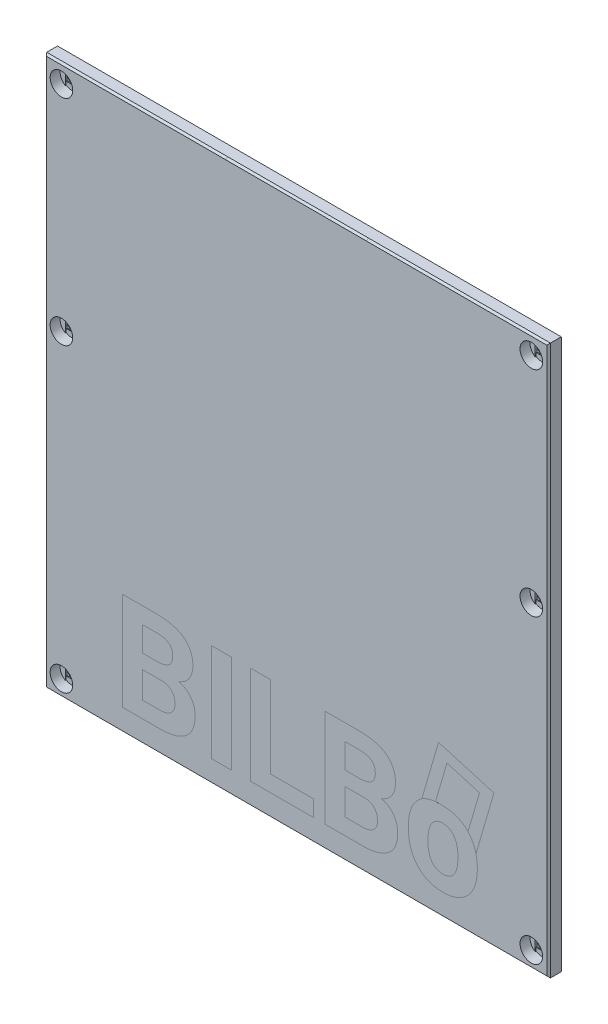
from build123d import *
from build123d.topology import SkipClean

# Parameters (mm, degrees)
SKETCH1_R             = 1.35
BOSS_EXTRUDE1_DEPTH   = 2.8
SKETCH3_R             = 2.5
CUT_EXTRUDE1_DEPTH    = 2.2
SKETCH4_W             = 91.3
SKETCH4_H             = 85.4
CUT_EXTRUDE2_DEPTH    = 1.5
CUT_EXTRUDE3_DEPTH    = 0.2
SKETCH6_W             = 2.7
SKETCH6_H             = 2.7
CUT_EXTRUDE4_DEPTH    = 0.2
CHAMFER1_SIZE         = 0.4
BOSS_EXTRUDE4_START   = -2.8
SKETCH11_W            = 31.175
SKETCH11_H            = 25.7
BOSS_EXTRUDE4_DEPTH   = 2.8
CHAMFER2_SIZE         = 0.4
SKETCH13_W            = 4.464730949
SKETCH13_H            = 21.668834196
CUT_EXTRUDE5_DEPTH    = 0.6
BOSS_EXTRUDE6_DEPTH   = 0.6
SKETCH13_4_W          = 4.464730949
SKETCH13_4_H          = 21.668834196
BOSS_EXTRUDE6_2_DEPTH = 0.6
BOSS_EXTRUDE6_3_DEPTH = 0.6
BOSS_EXTRUDE6_4_DEPTH = 0.6
BOSS_EXTRUDE6_5_DEPTH = 0.6
CUT_EXTRUDE6_DEPTH    = 0.6
BOSS_EXTRUDE7_DEPTH   = 0.6


with BuildPart() as part:
    # Sketch1 → Boss-Extrude1 (new body)
    with BuildSketch(Plane.XY):
        Polygon((-15.25, 54.05), (-15.25, 28.75), (15.125, 28.75), (15.125, 54.05), (55.825, 54.05), (55.825, -67.65), (-55.65, -67.65), (-55.65, 54.05), align=None)
        with Locations((-52, 50)):
            Circle(SKETCH1_R, mode=Mode.SUBTRACT)
        with Locations((-52, 2.6)):
            Circle(SKETCH1_R, mode=Mode.SUBTRACT)
        with Locations((-52, -64)):
            Circle(SKETCH1_R, mode=Mode.SUBTRACT)
        with Locations((52, 50)):
            Circle(SKETCH1_R, mode=Mode.SUBTRACT)
        with Locations((52, 2.6)):
            Circle(SKETCH1_R, mode=Mode.SUBTRACT)
        with Locations((52, -64)):
            Circle(SKETCH1_R, mode=Mode.SUBTRACT)
    extrude(amount=BOSS_EXTRUDE1_DEPTH)

    # Sketch3 → Cut-Extrude1 (cut)
    with BuildSketch(Plane.XY.offset(2.8)):
        with Locations((-52, 50)):
            Circle(SKETCH3_R)
        with Locations((-52, 2.6)):
            Circle(SKETCH3_R)
        with Locations((-52, -64)):
            Circle(SKETCH3_R)
        with Locations((52, -64)):
            Circle(SKETCH3_R)
        with Locations((52, 2.6)):
            Circle(SKETCH3_R)
        with Locations((52, 50)):
            Circle(SKETCH3_R)
    extrude(amount=-CUT_EXTRUDE1_DEPTH, mode=Mode.SUBTRACT)

    # Sketch4 → Cut-Extrude2 (cut)
    with BuildSketch(Plane(origin=(0, 0, 0), x_dir=(-1, 0, 0), z_dir=(0, 0, -1))):
        with Locations((0, -14.95)):
            Rectangle(SKETCH4_W, SKETCH4_H)
    extrude(amount=-CUT_EXTRUDE2_DEPTH, mode=Mode.SUBTRACT)

    # Sketch5 → Cut-Extrude3 (cut)
    with SkipClean():  # the faces are left unmerged after this step: merging them gives an invalid solid
        with BuildSketch(Plane.XY.offset(0.6)):
            with BuildLine():
                Line((-53.35, 47.895837459), (-53.35, 52.104162541))
                ThreePointArc((-53.35, 52.104162541), (-52, 52.5), (-50.65, 52.104162541))
                Line((-50.65, 52.104162541), (-50.65, 47.895837459))
                ThreePointArc((-50.65, 47.895837459), (-52, 47.5), (-53.35, 47.895837459))
            make_face()
            with BuildLine():
                Line((-53.35, 0.495837459), (-53.35, 4.704162541))
                ThreePointArc((-53.35, 4.704162541), (-52, 5.1), (-50.65, 4.704162541))
                Line((-50.65, 4.704162541), (-50.65, 0.495837459))
                ThreePointArc((-50.65, 0.495837459), (-52, 0.1), (-53.35, 0.495837459))
            make_face()
            with BuildLine():
                Line((-53.35, -66.104162541), (-53.35, -61.895837459))
                ThreePointArc((-53.35, -61.895837459), (-52, -61.5), (-50.65, -61.895837459))
                Line((-50.65, -61.895837459), (-50.65, -66.104162541))
                ThreePointArc((-50.65, -66.104162541), (-52, -66.5), (-53.35, -66.104162541))
            make_face()
        cut_extrude3 = extrude(amount=-CUT_EXTRUDE3_DEPTH, mode=Mode.SUBTRACT)

    # Sketch6 → Cut-Extrude4 (cut)
    with SkipClean():  # the faces are left unmerged after this step: merging them gives an invalid solid
        with BuildSketch(Plane.XY.offset(0.4)):
            with Locations((-52, -64)):
                Rectangle(SKETCH6_W, SKETCH6_H)
            with Locations((-52, 2.6)):
                Rectangle(SKETCH6_W, SKETCH6_H)
            with Locations((-52, 50)):
                Rectangle(SKETCH6_W, SKETCH6_H)
        cut_extrude4 = extrude(amount=-CUT_EXTRUDE4_DEPTH, mode=Mode.SUBTRACT)

    # Mirror1: Cut-Extrude3, Cut-Extrude4 across plane
    with SkipClean():  # the faces are left unmerged after this step: merging them gives an invalid solid
        add(cut_extrude3.mirror(Plane(origin=(0, 0, 0), x_dir=(0, 0, 1), z_dir=(1, 0, 0))), mode=Mode.SUBTRACT)
        add(cut_extrude4.mirror(Plane(origin=(0, 0, 0), x_dir=(0, 0, 1), z_dir=(1, 0, 0))), mode=Mode.SUBTRACT)

    # Chamfer1
    chamfer1_edges = [part.edges().sort_by_distance(p)[0] for p in [
        (55.825, -6.8, 2.8),
        (35.475, 54.05, 2.8),
        (15.125, 41.4, 2.8),
        (-0.0625, 28.75, 2.8),
        (-15.25, 41.4, 2.8),
        (-35.45, 54.05, 2.8),
        (-55.65, -6.8, 2.8),
        (0.0875, -67.65, 2.8),
    ]]
    chamfer(chamfer1_edges, length=CHAMFER1_SIZE)

    # Sketch11 → Boss-Extrude4 (add)
    with SkipClean():  # the faces are left unmerged after this step: merging them gives an invalid solid
        with BuildSketch(Plane.XY.offset(2.8).offset(BOSS_EXTRUDE4_START)):
            with Locations((-0.0625, 41.2)):
                Rectangle(SKETCH11_W, SKETCH11_H)
        extrude(amount=BOSS_EXTRUDE4_DEPTH)

    # Chamfer2
    chamfer2_edges = [part.edges().sort_by_distance(p)[0] for p in [
        (-0.0625, 54.05, 2.8),
    ]]
    chamfer(chamfer2_edges, length=CHAMFER2_SIZE - 0.0001)  # a hair under: the kernel refuses the full size

    # Sketch13 → Cut-Extrude5 (cut)
    # profile 1 of 5: a face of its own
    with BuildSketch(Plane.XY.offset(2.8)):
        with BuildLine():
            add(Edge.make_bspline(
                [(-24.407221393, -61.076300822), (-25.736719114, -62.147835169), (-27.631749376, -62.693531332), (-30.092312179, -62.713375811)],
                knots=[0, 0, 0, 0, 1, 1, 1, 1], degree=3))
            Line((-30.092312179, -62.713375811), (-38.51577092, -62.713375811))
            Line((-38.51577092, -62.713375811), (-38.51577092, -41.044541615))
            Line((-38.51577092, -41.044541615), (-30.925728983, -41.044541615))
            add(Edge.make_bspline(
                [(-30.925728983, -41.044541615), (-28.296498911, -41.044541615), (-26.302251655, -41.550548821), (-24.942988567, -42.562549733)],
                knots=[0, 0, 0, 0, 1, 1, 1, 1], degree=3))
            add(Edge.make_bspline(
                [(-24.942988567, -42.562549733), (-23.583726829, -43.564641905), (-22.904095285, -45.037993195), (-22.904095285, -46.982630604)],
                knots=[0, 0, 0, 0, 1, 1, 1, 1], degree=3))
            add(Edge.make_bspline(
                [(-22.904095285, -46.982630604), (-22.904095285, -48.044256212), (-23.176940667, -48.981847079), (-23.72263008, -49.795416704)],
                knots=[0, 0, 0, 0, 1, 1, 1, 1], degree=3))
            add(Edge.make_bspline(
                [(-23.72263008, -49.795416704), (-24.268319493, -50.59906409), (-25.027323552, -51.18940358), (-25.999642256, -51.566421674)],
                knots=[0, 0, 0, 0, 1, 1, 1, 1], degree=3))
            add(Edge.make_bspline(
                [(-25.999642256, -51.566421674), (-24.888420301, -51.844230876), (-24.01531724, -52.404803648), (-23.380333073, -53.248139991)],
                knots=[0, 0, 0, 0, 1, 1, 1, 1], degree=3))
            add(Edge.make_bspline(
                [(-23.380333073, -53.248139991), (-22.735428016, -54.091476334), (-22.412975488, -55.123335224), (-22.412975488, -56.343689661)],
                knots=[0, 0, 0, 0, 1, 1, 1, 1], degree=3))
            add(Edge.make_bspline(
                [(-22.412975488, -56.343689661), (-22.412975488, -58.42723842), (-23.077723673, -60.004766474), (-24.407221393, -61.076300822)],
                knots=[0, 0, 0, 0, 1, 1, 1, 1], degree=3))
        make_face()
        with BuildLine():
            add(Edge.make_bspline(
                [(-28.232007055, -45.315802397), (-28.797540947, -44.879250866), (-29.695448256, -44.660975101), (-30.925728983, -44.660975101)],
                knots=[0, 0, 0, 0, 1, 1, 1, 1], degree=3))
            Line((-30.925728983, -44.660975101), (-34.051039972, -44.660975101))
            Line((-34.051039972, -44.660975101), (-34.051039972, -50.122823602))
            Line((-34.051039972, -50.122823602), (-30.747139475, -50.122823602))
            add(Edge.make_bspline(
                [(-30.747139475, -50.122823602), (-28.494930197, -50.083134645), (-27.368826233, -49.185232735), (-27.368826233, -47.429104374)],
                knots=[0, 0, 0, 0, 1, 1, 1, 1], degree=3))
            add(Edge.make_bspline(
                [(-27.368826233, -47.429104374), (-27.368826233, -46.44687018), (-27.656553624, -45.742431688), (-28.232007055, -45.315802397)],
                knots=[0, 0, 0, 0, 1, 1, 1, 1], degree=3))
        make_face(mode=Mode.SUBTRACT)
        with BuildLine():
            add(Edge.make_bspline(
                [(-26.877706437, -56.299046334), (-26.877706437, -54.314719968), (-27.904594757, -53.307673427), (-29.958370048, -53.277906709)],
                knots=[0, 0, 0, 0, 1, 1, 1, 1], degree=3))
            Line((-29.958370048, -53.277906709), (-34.051039972, -53.277906709))
            Line((-34.051039972, -53.277906709), (-34.051039972, -59.126709043))
            Line((-34.051039972, -59.126709043), (-30.22625431, -59.126709043))
            add(Edge.make_bspline(
                [(-30.22625431, -59.126709043), (-29.174561741, -59.126709043), (-28.356028297, -58.87866656), (-27.770652626, -58.382581594)],
                knots=[0, 0, 0, 0, 1, 1, 1, 1], degree=3))
            add(Edge.make_bspline(
                [(-27.770652626, -58.382581594), (-27.175354716, -57.876574388), (-26.877706437, -57.182071635), (-26.877706437, -56.299046334)],
                knots=[0, 0, 0, 0, 1, 1, 1, 1], degree=3))
        make_face(mode=Mode.SUBTRACT)
    # profile 2 of 5: a face of its own
    with BuildSketch(Plane.XY.offset(2.8)):
        with Locations((-16.54929452, -51.878958713)):
            Rectangle(SKETCH13_W, SKETCH13_H)
    # profile 3 of 5: a face of its own
    with BuildSketch(Plane.XY.offset(2.8)):
        Polygon((-5.714880797, -41.044541615), (-5.714880797, -59.126709043), (3.765237033, -59.126709043), (3.765237033, -62.713375811), (-10.179611745, -62.713375811), (-10.179611745, -41.044541615), align=None)
    # profile 4 of 5: a face of its own
    with BuildSketch(Plane.XY.offset(2.8)):
        with BuildLine():
            add(Edge.make_bspline(
                [(20.433559607, -61.076300822), (19.104060537, -62.147835169), (17.209034324, -62.693531332), (14.748467471, -62.713375811)],
                knots=[0, 0, 0, 0, 1, 1, 1, 1], degree=3))
            Line((14.748467471, -62.713375811), (6.32501278, -62.713375811))
            Line((6.32501278, -62.713375811), (6.32501278, -41.044541615))
            Line((6.32501278, -41.044541615), (13.915053367, -41.044541615))
            add(Edge.make_bspline(
                [(13.915053367, -41.044541615), (16.544284789, -41.044541615), (18.538533395, -41.550548821), (19.897799183, -42.562549733)],
                knots=[0, 0, 0, 0, 1, 1, 1, 1], degree=3))
            add(Edge.make_bspline(
                [(19.897799183, -42.562549733), (21.257064971, -43.564641905), (21.936691115, -45.037993195), (21.936691115, -46.982630604)],
                knots=[0, 0, 0, 0, 1, 1, 1, 1], degree=3))
            add(Edge.make_bspline(
                [(21.936691115, -46.982630604), (21.936691115, -48.044256212), (21.663849783, -48.981847079), (21.11815362, -49.795416704)],
                knots=[0, 0, 0, 0, 1, 1, 1, 1], degree=3))
            add(Edge.make_bspline(
                [(21.11815362, -49.795416704), (20.572457457, -50.59906409), (19.813453399, -51.18940358), (18.841141444, -51.566421674)],
                knots=[0, 0, 0, 0, 1, 1, 1, 1], degree=3))
            add(Edge.make_bspline(
                [(18.841141444, -51.566421674), (19.952364749, -51.844230876), (20.82546781, -52.404803648), (21.460450627, -53.248139991)],
                knots=[0, 0, 0, 0, 1, 1, 1, 1], degree=3))
            add(Edge.make_bspline(
                [(21.460450627, -53.248139991), (22.105355684, -54.091476334), (22.427808212, -55.123335224), (22.427808212, -56.343689661)],
                knots=[0, 0, 0, 0, 1, 1, 1, 1], degree=3))
            add(Edge.make_bspline(
                [(22.427808212, -56.343689661), (22.427808212, -58.42723842), (21.763058677, -60.004766474), (20.433559607, -61.076300822)],
                knots=[0, 0, 0, 0, 1, 1, 1, 1], degree=3))
        make_face()
        with BuildLine():
            add(Edge.make_bspline(
                [(16.608772595, -45.315802397), (16.043245453, -44.879250866), (15.145343544, -44.660975101), (13.915053367, -44.660975101)],
                knots=[0, 0, 0, 0, 1, 1, 1, 1], degree=3))
            Line((13.915053367, -44.660975101), (10.789736978, -44.660975101))
            Line((10.789736978, -44.660975101), (10.789736978, -50.122823602))
            Line((10.789736978, -50.122823602), (14.093640175, -50.122823602))
            add(Edge.make_bspline(
                [(14.093640175, -50.122823602), (16.345853503, -50.083134645), (17.471953417, -49.185232735), (17.471953417, -47.429104374)],
                knots=[0, 0, 0, 0, 1, 1, 1, 1], degree=3))
            add(Edge.make_bspline(
                [(17.471953417, -47.429104374), (17.471953417, -46.44687018), (17.184221976, -45.742431688), (16.608772595, -45.315802397)],
                knots=[0, 0, 0, 0, 1, 1, 1, 1], degree=3))
        make_face(mode=Mode.SUBTRACT)
        with BuildLine():
            add(Edge.make_bspline(
                [(17.963070514, -56.299046334), (17.963070514, -54.314719968), (16.936179493, -53.307673427), (14.882410952, -53.277906709)],
                knots=[0, 0, 0, 0, 1, 1, 1, 1], degree=3))
            Line((14.882410952, -53.277906709), (10.789736978, -53.277906709))
            Line((10.789736978, -53.277906709), (10.789736978, -59.126709043))
            Line((10.789736978, -59.126709043), (14.61452399, -59.126709043))
            add(Edge.make_bspline(
                [(14.61452399, -59.126709043), (15.666213859, -59.126709043), (16.484751354, -58.87866656), (17.070122974, -58.382581594)],
                knots=[0, 0, 0, 0, 1, 1, 1, 1], degree=3))
            add(Edge.make_bspline(
                [(17.070122974, -58.382581594), (17.665416834, -57.876574388), (17.963070514, -57.182071635), (17.963070514, -56.299046334)],
                knots=[0, 0, 0, 0, 1, 1, 1, 1], degree=3))
        make_face(mode=Mode.SUBTRACT)
    # profile 5 of 5: a face of its own
    with BuildSketch(Plane.XY.offset(2.8)):
        with BuildLine():
            add(Edge.make_bspline(
                [(26.875252864, -60.481020462), (25.496142598, -58.992779062), (24.806594214, -56.968763739), (24.806594214, -54.408974492)],
                knots=[0, 0, 0, 0, 1, 1, 1, 1], degree=3))
            Line((24.806594214, -54.408974492), (24.806487189, -54.102218234))
            add(Edge.make_bspline(
                [(24.806487189, -54.102218234), (24.738200022, -52.506292484), (24.984630266, -51.070691782), (25.545764434, -49.795416704)],
                knots=[0, 0, 0, 0, 1, 1, 1, 1], degree=3))
            add(Edge.make_bspline(
                [(25.545764434, -49.795416704), (26.120326009, -48.563886432), (26.961842681, -47.602688448), (28.070314451, -46.911822752)],
                knots=[0, 0, 0, 0, 1, 1, 1, 1], degree=3))
            add(Edge.make_bspline(
                [(28.070314451, -46.911822752), (29.451065178, -46.251385609), (31.005824862, -45.996290415), (32.734608777, -46.146538498)],
                knots=[0, 0, 0, 0, 1, 1, 1, 1], degree=3))
            add(Edge.make_bspline(
                [(32.734608777, -46.146538498), (34.906668025, -46.204610501), (36.659287521, -46.916455474), (37.992440278, -48.282072694)],
                knots=[0, 0, 0, 0, 1, 1, 1, 1], degree=3))
            add(Edge.make_bspline(
                [(37.992440278, -48.282072694), (39.395795636, -49.87736722), (40.081256161, -51.94351025), (40.048823083, -54.480486864)],
                knots=[0, 0, 0, 0, 1, 1, 1, 1], degree=3))
            Line((40.048823083, -54.480486864), (40.061098933, -54.528041364))
            add(Edge.make_bspline(
                [(40.061098933, -54.528041364), (40.061098933, -56.998516957), (39.37155055, -58.982843323), (37.992440283, -60.481020462)],
                knots=[0, 0, 0, 0, 1, 1, 1, 1], degree=3))
            add(Edge.make_bspline(
                [(37.992440283, -60.481020462), (36.613330016, -61.969261861), (34.762947131, -62.713375811), (32.441291628, -62.713375811)],
                knots=[0, 0, 0, 0, 1, 1, 1, 1], degree=3))
            add(Edge.make_bspline(
                [(32.441291628, -62.713375811), (30.119636125, -62.713375811), (28.26428537, -61.969261861), (26.875252864, -60.481020462)],
                knots=[0, 0, 0, 0, 1, 1, 1, 1], degree=3))
        make_face()
        with BuildLine():
            add(Edge.make_bspline(
                [(29.970735037, -50.73302107), (29.395285656, -51.546590695), (29.107554215, -52.81160196), (29.107554215, -54.528041364)],
                knots=[0, 0, 0, 0, 1, 1, 1, 1], degree=3))
            add(Edge.make_bspline(
                [(29.107554215, -54.528041364), (29.107554215, -56.055971721), (29.395285656, -57.226714962), (29.970735037, -58.040298087)],
                knots=[0, 0, 0, 0, 1, 1, 1, 1], degree=3))
            add(Edge.make_bspline(
                [(29.970735037, -58.040298087), (30.546184418, -58.843945472), (31.369689782, -59.245775915), (32.44122413, -59.245775915)],
                knots=[0, 0, 0, 0, 1, 1, 1, 1], degree=3))
            add(Edge.make_bspline(
                [(32.44122413, -59.245775915), (33.48299176, -59.245775915), (34.296561385, -58.848913342), (34.881946505, -58.055174696)],
                knots=[0, 0, 0, 0, 1, 1, 1, 1], degree=3))
            add(Edge.make_bspline(
                [(34.881946505, -58.055174696), (35.467318125, -57.25152731), (35.760003936, -55.971639436), (35.760003936, -54.215511075)],
                knots=[0, 0, 0, 0, 1, 1, 1, 1], degree=3))
            add(Edge.make_bspline(
                [(35.760003936, -54.215511075), (35.760003936, -52.717347436), (35.467318125, -51.556512935), (34.881946505, -50.73302107)],
                knots=[0, 0, 0, 0, 1, 1, 1, 1], degree=3))
            add(Edge.make_bspline(
                [(34.881946505, -50.73302107), (34.296561385, -49.909529206), (33.47306952, -49.497776524), (32.411457412, -49.497776524)],
                knots=[0, 0, 0, 0, 1, 1, 1, 1], degree=3))
            add(Edge.make_bspline(
                [(32.411457412, -49.497776524), (31.359767543, -49.497776524), (30.546184418, -49.909529206), (29.970735037, -50.73302107)],
                knots=[0, 0, 0, 0, 1, 1, 1, 1], degree=3))
        make_face(mode=Mode.SUBTRACT)
    extrude(amount=-CUT_EXTRUDE5_DEPTH, mode=Mode.SUBTRACT)

    # Sketch13<5> → Cut-Extrude6 (cut)
    with BuildSketch(Plane.XY.offset(2.8)):
        with BuildLine():
            Line((43.733243962, -38.044291556), (31.465307472, -34.458596942))
            Line((31.465307472, -34.458596942), (27.766834298, -47.112388993))
            add(Edge.make_bspline(
                [(27.766834298, -47.112388993), (27.865667548, -47.043177342), (27.966827599, -46.976321929), (28.070314451, -46.911822752)],
                knots=[0.906640065, 0.906640065, 0.906640065, 0.906640065, 1, 1, 1, 1], degree=3))
            add(Edge.make_bspline(
                [(28.070314451, -46.911822752), (28.913646118, -46.508442514), (29.821891708, -46.256274816), (30.795054702, -46.155319959)],
                knots=[0, 0, 0, 0, 0.610777637, 0.610777637, 0.610777637, 0.610777637], degree=3))
            Line((30.795054702, -46.155319959), (33.32580891, -37.496709777))
            Line((33.32580891, -37.496709777), (40.529411542, -39.602191752))
            Line((40.529411542, -39.602191752), (37.992440278, -48.282072694))
            add(Edge.make_bspline(
                [(37.992440278, -48.282072694), (38.838385213, -49.243718877), (39.423468819, -50.376457205), (39.747691366, -51.68028441)],
                knots=[0, 0, 0, 0, 0.602801657, 0.602801657, 0.602801657, 0.602801657], degree=3))
            Line((39.747691366, -51.68028441), (43.733243962, -38.044291556))
        make_face()
    extrude(amount=-CUT_EXTRUDE6_DEPTH, mode=Mode.SUBTRACT)


with BuildPart() as body_2:
    # Sketch13<4> → Boss-Extrude6 (new body)
    with BuildSketch(Plane.XY.offset(2.8)):
        with BuildLine():
            add(Edge.make_bspline(
                [(-24.407221393, -61.076300822), (-25.736719114, -62.147835169), (-27.631749376, -62.693531332), (-30.092312179, -62.713375811)],
                knots=[0, 0, 0, 0, 1, 1, 1, 1], degree=3))
            Line((-30.092312179, -62.713375811), (-38.51577092, -62.713375811))
            Line((-38.51577092, -62.713375811), (-38.51577092, -41.044541615))
            Line((-38.51577092, -41.044541615), (-30.925728983, -41.044541615))
            add(Edge.make_bspline(
                [(-30.925728983, -41.044541615), (-28.296498911, -41.044541615), (-26.302251655, -41.550548821), (-24.942988567, -42.562549733)],
                knots=[0, 0, 0, 0, 1, 1, 1, 1], degree=3))
            add(Edge.make_bspline(
                [(-24.942988567, -42.562549733), (-23.583726829, -43.564641905), (-22.904095285, -45.037993195), (-22.904095285, -46.982630604)],
                knots=[0, 0, 0, 0, 1, 1, 1, 1], degree=3))
            add(Edge.make_bspline(
                [(-22.904095285, -46.982630604), (-22.904095285, -48.044256212), (-23.176940667, -48.981847079), (-23.72263008, -49.795416704)],
                knots=[0, 0, 0, 0, 1, 1, 1, 1], degree=3))
            add(Edge.make_bspline(
                [(-23.72263008, -49.795416704), (-24.268319493, -50.59906409), (-25.027323552, -51.18940358), (-25.999642256, -51.566421674)],
                knots=[0, 0, 0, 0, 1, 1, 1, 1], degree=3))
            add(Edge.make_bspline(
                [(-25.999642256, -51.566421674), (-24.888420301, -51.844230876), (-24.01531724, -52.404803648), (-23.380333073, -53.248139991)],
                knots=[0, 0, 0, 0, 1, 1, 1, 1], degree=3))
            add(Edge.make_bspline(
                [(-23.380333073, -53.248139991), (-22.735428016, -54.091476334), (-22.412975488, -55.123335224), (-22.412975488, -56.343689661)],
                knots=[0, 0, 0, 0, 1, 1, 1, 1], degree=3))
            add(Edge.make_bspline(
                [(-22.412975488, -56.343689661), (-22.412975488, -58.42723842), (-23.077723673, -60.004766474), (-24.407221393, -61.076300822)],
                knots=[0, 0, 0, 0, 1, 1, 1, 1], degree=3))
        make_face()
        with BuildLine():
            add(Edge.make_bspline(
                [(-28.232007055, -45.315802397), (-28.797540947, -44.879250866), (-29.695448256, -44.660975101), (-30.925728983, -44.660975101)],
                knots=[0, 0, 0, 0, 1, 1, 1, 1], degree=3))
            Line((-30.925728983, -44.660975101), (-34.051039972, -44.660975101))
            Line((-34.051039972, -44.660975101), (-34.051039972, -50.122823602))
            Line((-34.051039972, -50.122823602), (-30.747139475, -50.122823602))
            add(Edge.make_bspline(
                [(-30.747139475, -50.122823602), (-28.494930197, -50.083134645), (-27.368826233, -49.185232735), (-27.368826233, -47.429104374)],
                knots=[0, 0, 0, 0, 1, 1, 1, 1], degree=3))
            add(Edge.make_bspline(
                [(-27.368826233, -47.429104374), (-27.368826233, -46.44687018), (-27.656553624, -45.742431688), (-28.232007055, -45.315802397)],
                knots=[0, 0, 0, 0, 1, 1, 1, 1], degree=3))
        make_face(mode=Mode.SUBTRACT)
        with BuildLine():
            add(Edge.make_bspline(
                [(-26.877706437, -56.299046334), (-26.877706437, -54.314719968), (-27.904594757, -53.307673427), (-29.958370048, -53.277906709)],
                knots=[0, 0, 0, 0, 1, 1, 1, 1], degree=3))
            Line((-29.958370048, -53.277906709), (-34.051039972, -53.277906709))
            Line((-34.051039972, -53.277906709), (-34.051039972, -59.126709043))
            Line((-34.051039972, -59.126709043), (-30.22625431, -59.126709043))
            add(Edge.make_bspline(
                [(-30.22625431, -59.126709043), (-29.174561741, -59.126709043), (-28.356028297, -58.87866656), (-27.770652626, -58.382581594)],
                knots=[0, 0, 0, 0, 1, 1, 1, 1], degree=3))
            add(Edge.make_bspline(
                [(-27.770652626, -58.382581594), (-27.175354716, -57.876574388), (-26.877706437, -57.182071635), (-26.877706437, -56.299046334)],
                knots=[0, 0, 0, 0, 1, 1, 1, 1], degree=3))
        make_face(mode=Mode.SUBTRACT)
    extrude(amount=-BOSS_EXTRUDE6_DEPTH)


with BuildPart() as body_3:
    # Sketch13<4> → Boss-Extrude6 2 (new body)
    with BuildSketch(Plane.XY.offset(2.8)):
        with Locations((-16.54929452, -51.878958713)):
            Rectangle(SKETCH13_4_W, SKETCH13_4_H)
    extrude(amount=-BOSS_EXTRUDE6_2_DEPTH)


with BuildPart() as body_4:
    # Sketch13<4> → Boss-Extrude6 3 (new body)
    with BuildSketch(Plane.XY.offset(2.8)):
        Polygon((-5.714880797, -41.044541615), (-5.714880797, -59.126709043), (3.765237033, -59.126709043), (3.765237033, -62.713375811), (-10.179611745, -62.713375811), (-10.179611745, -41.044541615), align=None)
    extrude(amount=-BOSS_EXTRUDE6_3_DEPTH)


with BuildPart() as body_5:
    # Sketch13<4> → Boss-Extrude6 4 (new body)
    with BuildSketch(Plane.XY.offset(2.8)):
        with BuildLine():
            add(Edge.make_bspline(
                [(20.433559607, -61.076300822), (19.104060537, -62.147835169), (17.209034324, -62.693531332), (14.748467471, -62.713375811)],
                knots=[0, 0, 0, 0, 1, 1, 1, 1], degree=3))
            Line((14.748467471, -62.713375811), (6.32501278, -62.713375811))
            Line((6.32501278, -62.713375811), (6.32501278, -41.044541615))
            Line((6.32501278, -41.044541615), (13.915053367, -41.044541615))
            add(Edge.make_bspline(
                [(13.915053367, -41.044541615), (16.544284789, -41.044541615), (18.538533395, -41.550548821), (19.897799183, -42.562549733)],
                knots=[0, 0, 0, 0, 1, 1, 1, 1], degree=3))
            add(Edge.make_bspline(
                [(19.897799183, -42.562549733), (21.257064971, -43.564641905), (21.936691115, -45.037993195), (21.936691115, -46.982630604)],
                knots=[0, 0, 0, 0, 1, 1, 1, 1], degree=3))
            add(Edge.make_bspline(
                [(21.936691115, -46.982630604), (21.936691115, -48.044256212), (21.663849783, -48.981847079), (21.11815362, -49.795416704)],
                knots=[0, 0, 0, 0, 1, 1, 1, 1], degree=3))
            add(Edge.make_bspline(
                [(21.11815362, -49.795416704), (20.572457457, -50.59906409), (19.813453399, -51.18940358), (18.841141444, -51.566421674)],
                knots=[0, 0, 0, 0, 1, 1, 1, 1], degree=3))
            add(Edge.make_bspline(
                [(18.841141444, -51.566421674), (19.952364749, -51.844230876), (20.82546781, -52.404803648), (21.460450627, -53.248139991)],
                knots=[0, 0, 0, 0, 1, 1, 1, 1], degree=3))
            add(Edge.make_bspline(
                [(21.460450627, -53.248139991), (22.105355684, -54.091476334), (22.427808212, -55.123335224), (22.427808212, -56.343689661)],
                knots=[0, 0, 0, 0, 1, 1, 1, 1], degree=3))
            add(Edge.make_bspline(
                [(22.427808212, -56.343689661), (22.427808212, -58.42723842), (21.763058677, -60.004766474), (20.433559607, -61.076300822)],
                knots=[0, 0, 0, 0, 1, 1, 1, 1], degree=3))
        make_face()
        with BuildLine():
            add(Edge.make_bspline(
                [(16.608772595, -45.315802397), (16.043245453, -44.879250866), (15.145343544, -44.660975101), (13.915053367, -44.660975101)],
                knots=[0, 0, 0, 0, 1, 1, 1, 1], degree=3))
            Line((13.915053367, -44.660975101), (10.789736978, -44.660975101))
            Line((10.789736978, -44.660975101), (10.789736978, -50.122823602))
            Line((10.789736978, -50.122823602), (14.093640175, -50.122823602))
            add(Edge.make_bspline(
                [(14.093640175, -50.122823602), (16.345853503, -50.083134645), (17.471953417, -49.185232735), (17.471953417, -47.429104374)],
                knots=[0, 0, 0, 0, 1, 1, 1, 1], degree=3))
            add(Edge.make_bspline(
                [(17.471953417, -47.429104374), (17.471953417, -46.44687018), (17.184221976, -45.742431688), (16.608772595, -45.315802397)],
                knots=[0, 0, 0, 0, 1, 1, 1, 1], degree=3))
        make_face(mode=Mode.SUBTRACT)
        with BuildLine():
            add(Edge.make_bspline(
                [(17.963070514, -56.299046334), (17.963070514, -54.314719968), (16.936179493, -53.307673427), (14.882410952, -53.277906709)],
                knots=[0, 0, 0, 0, 1, 1, 1, 1], degree=3))
            Line((14.882410952, -53.277906709), (10.789736978, -53.277906709))
            Line((10.789736978, -53.277906709), (10.789736978, -59.126709043))
            Line((10.789736978, -59.126709043), (14.61452399, -59.126709043))
            add(Edge.make_bspline(
                [(14.61452399, -59.126709043), (15.666213859, -59.126709043), (16.484751354, -58.87866656), (17.070122974, -58.382581594)],
                knots=[0, 0, 0, 0, 1, 1, 1, 1], degree=3))
            add(Edge.make_bspline(
                [(17.070122974, -58.382581594), (17.665416834, -57.876574388), (17.963070514, -57.182071635), (17.963070514, -56.299046334)],
                knots=[0, 0, 0, 0, 1, 1, 1, 1], degree=3))
        make_face(mode=Mode.SUBTRACT)
    extrude(amount=-BOSS_EXTRUDE6_4_DEPTH)


with BuildPart() as body_6:
    # Sketch13<4> → Boss-Extrude6 5 (new body)
    with BuildSketch(Plane.XY.offset(2.8)):
        with BuildLine():
            add(Edge.make_bspline(
                [(26.875252864, -60.481020462), (25.496142598, -58.992779062), (24.806594214, -56.968763739), (24.806594214, -54.408974492)],
                knots=[0, 0, 0, 0, 1, 1, 1, 1], degree=3))
            Line((24.806594214, -54.408974492), (24.806487189, -54.102218234))
            add(Edge.make_bspline(
                [(24.806487189, -54.102218234), (24.738200022, -52.506292484), (24.984630266, -51.070691782), (25.545764434, -49.795416704)],
                knots=[0, 0, 0, 0, 1, 1, 1, 1], degree=3))
            add(Edge.make_bspline(
                [(25.545764434, -49.795416704), (26.120326009, -48.563886432), (26.961842681, -47.602688448), (28.070314451, -46.911822752)],
                knots=[0, 0, 0, 0, 1, 1, 1, 1], degree=3))
            add(Edge.make_bspline(
                [(28.070314451, -46.911822752), (29.451065178, -46.251385609), (31.005824862, -45.996290415), (32.734608777, -46.146538498)],
                knots=[0, 0, 0, 0, 1, 1, 1, 1], degree=3))
            add(Edge.make_bspline(
                [(32.734608777, -46.146538498), (34.906668025, -46.204610501), (36.659287521, -46.916455474), (37.992440278, -48.282072694)],
                knots=[0, 0, 0, 0, 1, 1, 1, 1], degree=3))
            add(Edge.make_bspline(
                [(37.992440278, -48.282072694), (39.395795636, -49.87736722), (40.081256161, -51.94351025), (40.048823083, -54.480486864)],
                knots=[0, 0, 0, 0, 1, 1, 1, 1], degree=3))
            Line((40.048823083, -54.480486864), (40.061098933, -54.528041364))
            add(Edge.make_bspline(
                [(40.061098933, -54.528041364), (40.061098933, -56.998516957), (39.37155055, -58.982843323), (37.992440283, -60.481020462)],
                knots=[0, 0, 0, 0, 1, 1, 1, 1], degree=3))
            add(Edge.make_bspline(
                [(37.992440283, -60.481020462), (36.613330016, -61.969261861), (34.762947131, -62.713375811), (32.441291628, -62.713375811)],
                knots=[0, 0, 0, 0, 1, 1, 1, 1], degree=3))
            add(Edge.make_bspline(
                [(32.441291628, -62.713375811), (30.119636125, -62.713375811), (28.26428537, -61.969261861), (26.875252864, -60.481020462)],
                knots=[0, 0, 0, 0, 1, 1, 1, 1], degree=3))
        make_face()
        with BuildLine():
            add(Edge.make_bspline(
                [(29.970735037, -50.73302107), (29.395285656, -51.546590695), (29.107554215, -52.81160196), (29.107554215, -54.528041364)],
                knots=[0, 0, 0, 0, 1, 1, 1, 1], degree=3))
            add(Edge.make_bspline(
                [(29.107554215, -54.528041364), (29.107554215, -56.055971721), (29.395285656, -57.226714962), (29.970735037, -58.040298087)],
                knots=[0, 0, 0, 0, 1, 1, 1, 1], degree=3))
            add(Edge.make_bspline(
                [(29.970735037, -58.040298087), (30.546184418, -58.843945472), (31.369689782, -59.245775915), (32.44122413, -59.245775915)],
                knots=[0, 0, 0, 0, 1, 1, 1, 1], degree=3))
            add(Edge.make_bspline(
                [(32.44122413, -59.245775915), (33.48299176, -59.245775915), (34.296561385, -58.848913342), (34.881946505, -58.055174696)],
                knots=[0, 0, 0, 0, 1, 1, 1, 1], degree=3))
            add(Edge.make_bspline(
                [(34.881946505, -58.055174696), (35.467318125, -57.25152731), (35.760003936, -55.971639436), (35.760003936, -54.215511075)],
                knots=[0, 0, 0, 0, 1, 1, 1, 1], degree=3))
            add(Edge.make_bspline(
                [(35.760003936, -54.215511075), (35.760003936, -52.717347436), (35.467318125, -51.556512935), (34.881946505, -50.73302107)],
                knots=[0, 0, 0, 0, 1, 1, 1, 1], degree=3))
            add(Edge.make_bspline(
                [(34.881946505, -50.73302107), (34.296561385, -49.909529206), (33.47306952, -49.497776524), (32.411457412, -49.497776524)],
                knots=[0, 0, 0, 0, 1, 1, 1, 1], degree=3))
            add(Edge.make_bspline(
                [(32.411457412, -49.497776524), (31.359767543, -49.497776524), (30.546184418, -49.909529206), (29.970735037, -50.73302107)],
                knots=[0, 0, 0, 0, 1, 1, 1, 1], degree=3))
        make_face(mode=Mode.SUBTRACT)
    extrude(amount=-BOSS_EXTRUDE6_5_DEPTH)


with BuildPart() as body_7:
    # Sketch13<6> → Boss-Extrude7 (new body)
    with BuildSketch(Plane.XY.offset(2.8)):
        with BuildLine():
            Line((43.733243962, -38.044291556), (31.465307472, -34.458596942))
            Line((31.465307472, -34.458596942), (27.766834298, -47.112388993))
            add(Edge.make_bspline(
                [(27.766834298, -47.112388993), (27.865667548, -47.043177342), (27.966827599, -46.976321929), (28.070314451, -46.911822752)],
                knots=[0.906640065, 0.906640065, 0.906640065, 0.906640065, 1, 1, 1, 1], degree=3))
            add(Edge.make_bspline(
                [(28.070314451, -46.911822752), (28.913646118, -46.508442514), (29.821891708, -46.256274816), (30.795054702, -46.155319959)],
                knots=[0, 0, 0, 0, 0.610777637, 0.610777637, 0.610777637, 0.610777637], degree=3))
            Line((30.795054702, -46.155319959), (33.32580891, -37.496709777))
            Line((33.32580891, -37.496709777), (40.529411542, -39.602191752))
            Line((40.529411542, -39.602191752), (37.992440278, -48.282072694))
            add(Edge.make_bspline(
                [(37.992440278, -48.282072694), (38.838385213, -49.243718877), (39.423468819, -50.376457205), (39.747691366, -51.68028441)],
                knots=[0, 0, 0, 0, 0.602801657, 0.602801657, 0.602801657, 0.602801657], degree=3))
            Line((39.747691366, -51.68028441), (43.733243962, -38.044291556))
        make_face()
    extrude(amount=-BOSS_EXTRUDE7_DEPTH)


solid = Compound([part.part, body_2.part, body_3.part, body_4.part, body_5.part, body_6.part, body_7.part])
